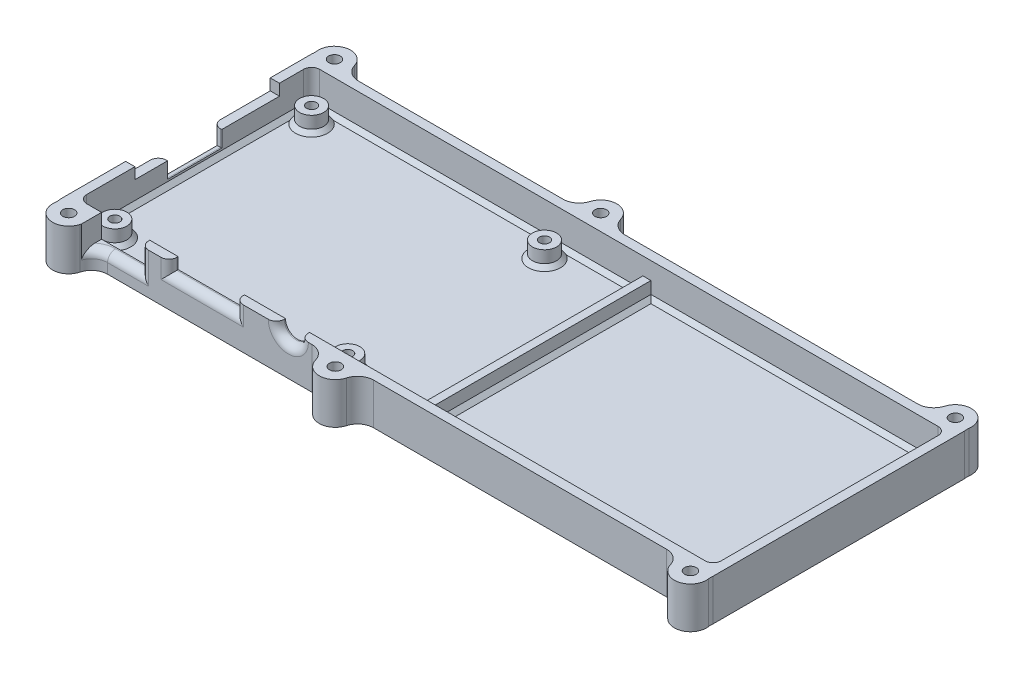
from build123d import *

# Parameters (mm, degrees)
SKETCH3_W                      = 162.6
SKETCH3_H                      = 62.6
SKETCH3_W_2                    = 158
SKETCH3_H_2                    = 58
BOSS_EXTRUDE1_DEPTH            = 10.3
SKETCH5_W                      = 158
SKETCH5_H                      = 58
BOSS_EXTRUDE2_DEPTH            = 2
SKETCH6_R                      = 3
BOSS_EXTRUDE3_DEPTH            = 4
F_2_5_2_5_DIAMETER_HOLE1_D     = 2.5
F_2_5_2_5_DIAMETER_HOLE1_DEPTH = 8
F_2_5_2_5_DIAMETER_HOLE1_TIP   = 0.751075774
SKETCH10_W                     = 2
SKETCH10_H                     = 58
BOSS_EXTRUDE4_DEPTH            = 4
CUT_EXTRUDE1_REACH             = 110.272
SKETCH11_R                     = 3
SKETCH11_W                     = 12
SKETCH11_H                     = 5.8
SKETCH11_W_2                   = 16.5
SKETCH11_H_2                   = 2.8
CUT_EXTRUDE2_REACH             = 168.519
SKETCH12_W                     = 13.5
SKETCH12_H                     = 6.8
SKETCH12_W_2                   = 36
SKETCH12_H_2                   = 2.8
SKETCH13_R                     = 4
BOSS_EXTRUDE5_DEPTH            = 10.3
FILLET2_R                      = 4
FILLET3_R                      = 4
FILLET4_R                      = 4
F_2_9_2_9_DIAMETER_HOLE1_D     = 2.9
FILLET6_R                      = 2
FILLET7_R                      = 2
FILLET8_R                      = 2
CHAMFER1_SIZE                  = 1
CHAMFER2_SIZE                  = 1
FILLET9_R                      = 2


with BuildPart() as part:
    # Sketch3 → Boss-Extrude1 (new body)
    with BuildSketch(Plane(origin=(0, 0, 0), x_dir=(1, 0, 0), z_dir=(0, 1, 0))):
        with Locations((6.438233838, 3.105993834)):
            Rectangle(SKETCH3_W, SKETCH3_H)
        with Locations((6.438233838, 3.105993834)):
            Rectangle(SKETCH3_W_2, SKETCH3_H_2, mode=Mode.SUBTRACT)
    extrude(amount=BOSS_EXTRUDE1_DEPTH)

    # Sketch5 → Boss-Extrude2 (add)
    with BuildSketch(Plane(origin=(0, 0, 0), x_dir=(1, 0, 0), z_dir=(0, 1, 0))):
        with Locations((6.438233838, 3.105993834)):
            Rectangle(SKETCH5_W, SKETCH5_H)
    extrude(amount=BOSS_EXTRUDE2_DEPTH)

    # Sketch6 → Boss-Extrude3 (add)
    with BuildSketch(Plane(origin=(0, 2, 0), x_dir=(1, 0, 0), z_dir=(0, 1, 0))):
        with Locations(Location((-68.061766162, 27.605993834, 0), (0, 0, 270))):
            Circle(SKETCH6_R)
        with Locations(Location((-68.061766162, -21.394006166, 0), (0, 0, 270))):
            Circle(SKETCH6_R)
        with Locations(Location((-10.061766162, -21.394006166, 0), (0, 0, 270))):
            Circle(SKETCH6_R)
        with Locations(Location((-10.061766162, 27.605993834, 0), (0, 0, 270))):
            Circle(SKETCH6_R)
    extrude(amount=BOSS_EXTRUDE3_DEPTH)

    # Ø2.5 (2.5) Diameter Hole1
    with Locations(Plane(origin=(0, 6, 0), x_dir=(1, 0, 0), z_dir=(0, 1, 0))):
        with Locations((-68.061766162, 27.605993834), (-10.061766162, 27.605993834), (-10.061766162, -21.394006166), (-68.061766162, -21.394006166)):
            Hole(F_2_5_2_5_DIAMETER_HOLE1_D / 2, depth=F_2_5_2_5_DIAMETER_HOLE1_DEPTH)
            with Locations((0, 0, -(F_2_5_2_5_DIAMETER_HOLE1_DEPTH + F_2_5_2_5_DIAMETER_HOLE1_TIP / 2))):  # 118° drill point
                Cone(0, F_2_5_2_5_DIAMETER_HOLE1_D / 2, F_2_5_2_5_DIAMETER_HOLE1_TIP, mode=Mode.SUBTRACT)

    # Sketch10 → Boss-Extrude4 (add)
    with BuildSketch(Plane(origin=(0, 2, 0), x_dir=(1, 0, 0), z_dir=(0, 1, 0))):
        with Locations((10.938233838, 3.105993834)):
            Rectangle(SKETCH10_W, SKETCH10_H)
    extrude(amount=BOSS_EXTRUDE4_DEPTH)

    # Sketch11 → Cut-Extrude1 (cut, up to next)
    with BuildSketch(Plane.XY.offset(28.194006166), mode=Mode.PRIVATE) as cut_extrude1_sk1:
        with Locations((-18.061766162, 10.3)):
            Circle(SKETCH11_R)
    cut_extrude1_tool1 = extrude(cut_extrude1_sk1.sketch, amount=-CUT_EXTRUDE1_REACH, mode=Mode.PRIVATE) & part.part
    # Sketch11 → Cut-Extrude1 (cut, up to next)
    with BuildSketch(Plane.XY.offset(28.194006166), mode=Mode.PRIVATE) as cut_extrude1_sk2:
        with Locations((-60.861766162, 7.4)):
            Rectangle(SKETCH11_W, SKETCH11_H)
    cut_extrude1_tool2 = extrude(cut_extrude1_sk2.sketch, amount=-CUT_EXTRUDE1_REACH, mode=Mode.PRIVATE) & part.part
    # Sketch11 → Cut-Extrude1 (cut, up to next)
    with BuildSketch(Plane.XY.offset(28.194006166), mode=Mode.PRIVATE) as cut_extrude1_sk3:
        with Locations((-39.527982648, 8.9)):
            Rectangle(SKETCH11_W_2, SKETCH11_H_2)
    cut_extrude1_tool3 = extrude(cut_extrude1_sk3.sketch, amount=-CUT_EXTRUDE1_REACH, mode=Mode.PRIVATE) & part.part
    add(cut_extrude1_tool1.solids().sort_by_distance((-18.061766, 10.3, 28.194006))[0], mode=Mode.SUBTRACT)
    add(cut_extrude1_tool2.solids().sort_by_distance((-60.861766, 7.4, 28.194006))[0], mode=Mode.SUBTRACT)
    add(cut_extrude1_tool3.solids().sort_by_distance((-39.527983, 8.9, 28.194006))[0], mode=Mode.SUBTRACT)

    # Sketch12 → Cut-Extrude2 (cut, up to next)
    with BuildSketch(Plane.ZY.offset(74.861766162), mode=Mode.PRIVATE) as cut_extrude2_sk1:
        with Locations((-2.982922372, 6.9)):
            Rectangle(SKETCH12_W, SKETCH12_H)
    cut_extrude2_tool1 = extrude(cut_extrude2_sk1.sketch, amount=-CUT_EXTRUDE2_REACH, mode=Mode.PRIVATE) & part.part
    # Sketch12 → Cut-Extrude2 (cut, up to next)
    with BuildSketch(Plane.ZY.offset(74.861766162), mode=Mode.PRIVATE) as cut_extrude2_sk2:
        with Locations((-6.105993834, 8.9)):
            Rectangle(SKETCH12_W_2, SKETCH12_H_2)
    cut_extrude2_tool2 = extrude(cut_extrude2_sk2.sketch, amount=-CUT_EXTRUDE2_REACH, mode=Mode.PRIVATE) & part.part
    add(cut_extrude2_tool1.solids().sort_by_distance((-74.861766, 6.9, -2.982922))[0], mode=Mode.SUBTRACT)
    add(cut_extrude2_tool2.solids().sort_by_distance((-74.861766, 8.9, -6.105994))[0], mode=Mode.SUBTRACT)

    # Sketch13 → Boss-Extrude5 (add)
    with BuildSketch(Plane(origin=(0, 0, 0), x_dir=(1, 0, 0), z_dir=(0, 1, 0))):
        with Locations((-70.861766162, 36.105993834)):
            Circle(SKETCH13_R)
        with Locations((-4.561766162, 36.105993834)):
            Circle(SKETCH13_R)
        with Locations((83.738233838, 36.105993834)):
            Circle(SKETCH13_R)
        with Locations((83.788193598, -29.900023528)):
            Circle(SKETCH13_R)
        with Locations((-4.511705229, -30.033691472)):
            Circle(SKETCH13_R)
        with Locations((-70.811629263, -30.134055965)):
            Circle(SKETCH13_R)
    extrude(amount=BOSS_EXTRUDE5_DEPTH)

    # Fillet2
    # the kernel refuses this fillet: 4 mm, written as the material it adds along each edge
    with BuildSketch(Plane(origin=(-74.48253956, 10.3, -34.405993834), x_dir=(-1, 0, 0), z_dir=(0, -1, 0))) as fillet2_piece_1:
        with BuildLine():
            CenterArc((4.316902517, 0.703355094), FILLET2_R, 172.843462622, 17.284010607)
            Line((0.348064559, 1.201677547), (0.2686878, 1.211643996))
            ThreePointArc((0.2686878, 1.211643996), (0.144462277, 0.609403692), (-0.072415468, 0.034))
            Line((-0.072415468, 0.034), (0, -0.08))
            ThreePointArc((0, -0.08), (0.189613301, -0.08), (0.300473084, -0.014067102))
            Line((0.300473084, -0.014067102), (0.379226602, 0))
        make_face()
    extrude(amount=10.3)

    # Fillet3
    fillet3_edges = [part.edges().sort_by_distance(p)[0] for p in [
        (80.170251537, 5.15, 28.194006166),
        (-67.313600279, 5.15, 28.194006166),
        (-0.959866554, 5.15, 28.194006166),
        (-8.063543904, 5.15, 28.194006166),
        (80.11746044, 5.15, -34.405993834),
        (-8.18253956, 5.15, -34.405993834),
        (-0.940992764, 5.15, -34.405993834),
        (-67.240992764, 5.15, -34.405993834),
    ]]
    fillet(fillet3_edges, radius=FILLET3_R)

    # Fillet4
    # the kernel refuses this fillet: 4 mm, written as the material it adds along each edge
    with BuildSketch(Plane(origin=(-74.309658248, 10.3, 28.194006166), x_dir=(-0.3104883041224667, 0, 0.9505771999175842), z_dir=(0, -1, 0))) as fillet4_piece_1:
        with BuildLine():
            CenterArc((2.274210055, 3.927509369), FILLET4_R, 238.284839943, 20.790532392)
            Line((0.17142305, 0.524821195), (0.12936731, 0.456767432))
            ThreePointArc((0.12936731, 0.456767432), (0.009665349, 0.287249662), (-0.076046176, 0.024839064))
            Line((-0.076046176, 0.024839064), (0.0151614, -0.078550187))
            ThreePointArc((0.0151614, -0.078550187), (0.758070018, -0.007509369), (1.500978636, -0.078550187))
            Line((1.500978636, -0.078550187), (1.516140037, 0))
        make_face()
    extrude(amount=10.3)
    with BuildSketch(Plane(origin=(87.40613566, 10.3, 28.194006166), x_dir=(0.28950004404714813, 0, 0.9571780004245288), z_dir=(0, -1, 0))) as fillet4_piece_2_section:
        with BuildLine():
            CenterArc((1.756703704, -3.95690665), FILLET4_R, 98.41789371, 16.110259487)
            Line((0.096142437, -0.31787707), (0.062931212, -0.245096478))
            ThreePointArc((0.062931212, -0.245096478), (-0.028503021, -0.182098539), (-0.07657424, -0.023160004))
            Line((-0.07657424, -0.023160004), (0.011711358, 0.079138133))
            ThreePointArc((0.011711358, 0.079138133), (0.585567901, 0.03690665), (1.159424444, 0.079138133))
            Line((1.159424444, 0.079138133), (1.171135802, 0))
        make_face()
    fillet4_piece_2 = extrude(amount=10.3, mode=Mode.PRIVATE)
    fillet4_piece_2 = split(fillet4_piece_2, bisect_by=Plane(origin=(87.738233838, 5.15, 28.552797163), z_dir=(-1, 0, 0)), keep=Keep.TOP, mode=Mode.PRIVATE)
    add(fillet4_piece_2)
    with BuildSketch(Plane(origin=(87.359007236, 10.3, -34.405993834), x_dir=(1, 0, 0), z_dir=(0, -1, 0))) as fillet4_piece_3:
        with BuildLine():
            CenterArc((4.316902517, -0.703355094), FILLET4_R, 169.87252677, 17.284010607)
            Line((0.348064559, -1.201677547), (0.2686878, -1.211643996))
            ThreePointArc((0.2686878, -1.211643996), (0.144462277, -0.609403692), (-0.072415468, -0.034))
            Line((-0.072415468, -0.034), (0, 0.08))
            ThreePointArc((0, 0.08), (0.189613301, 0.08), (0.300473084, 0.014067102))
            Line((0.300473084, 0.014067102), (0.379226602, 0))
        make_face()
    extrude(amount=10.3)

    # Ø2.9 (2.9) Diameter Hole1 (through all)
    with Locations(Plane(origin=(0, 10.3, 0), x_dir=(1, 0, 0), z_dir=(0, 1, 0))):
        with Locations((-70.861766162, 36.105993834), (-4.561766162, 36.105993834), (83.738233838, 36.105993834), (83.788193598, -29.900023528), (-4.511705229, -30.033691472), (-70.811629263, -30.134055965)):
            Hole(F_2_9_2_9_DIAMETER_HOLE1_D / 2)

    # Fillet6
    fillet6_edges = [part.edges().sort_by_distance(p)[0] for p in [
        (85.438233838, 6.15, -32.105993834),
    ]]
    fillet(fillet6_edges, radius=FILLET6_R)

    # Fillet7
    fillet7_edges = [part.edges().sort_by_distance(p)[0] for p in [
        (85.438233838, 6.15, 25.894006166),
    ]]
    fillet(fillet7_edges, radius=FILLET7_R)

    # Fillet8
    fillet8_edges = [part.edges().sort_by_distance(p)[0] for p in [
        (-72.561766162, 6.15, -32.105993834),
        (-72.561766162, 6.15, 25.894006166),
    ]]
    fillet(fillet8_edges, radius=FILLET8_R)

    # Chamfer1
    chamfer1_edges = [part.edges().sort_by_distance(p)[0] for p in [
        (-68.061766162, 2, -30.605993834),
        (-68.061766162, 2, 18.394006166),
        (-10.061766162, 2, 18.394006166),
        (-10.061766162, 2, -30.605993834),
    ]]
    chamfer(chamfer1_edges, length=CHAMFER1_SIZE)

    # Chamfer2
    # the kernel refuses this chamfer: 1 mm, written as the material it adds along each edge
    with BuildSketch(Plane(origin=(9.36655085, 2, -32.105993834), x_dir=(0, 0.9996219169112968, -0.027495876610589075), z_dir=(1, 0, 0)), Plane(origin=(83.438233838, 2, 25.894006166), x_dir=(0, 0.9996219169112968, 0.027495876610585623), z_dir=(-1, 0, 0))) as chamfer2_piece_1:
        Polygon((CHAMFER2_SIZE * 0.999621916911, CHAMFER2_SIZE * 0.0274958766106), (-CHAMFER2_SIZE * 0.0274958766106, CHAMFER2_SIZE * 0.999621916911), (0, 0), align=None)
    extrude(amount=74.071682988)
    with BuildSketch(Plane(origin=(83.438233838, 2, -30.105993834), x_dir=(1, 0, 0), z_dir=(0, 0, 1))) as chamfer2_piece_2:
        Polygon((2 - CHAMFER2_SIZE, 0), (2, CHAMFER2_SIZE), (2, 0), align=None)
    revolve(axis=Axis((83.438233838, 2, -30.105993834), (0, 1, 0)), revolution_arc=90)
    with BuildSketch(Plane(origin=(85.438233838, 2, -30.105993834), x_dir=(-0.9996219169112968, -0.02749587661058639, 0), z_dir=(0, 0, 1)), Plane(origin=(-72.561766162, 2, 23.894006166), x_dir=(0.9996219169112968, -0.027495876610586605, 0), z_dir=(0, 0, -1))) as chamfer2_piece_3:
        Polygon((CHAMFER2_SIZE * 0.999621916911, -CHAMFER2_SIZE * 0.0274958766106), (-CHAMFER2_SIZE * 0.0274958766106, -CHAMFER2_SIZE * 0.999621916911), (0, 0), align=None)
    extrude(amount=54)
    with BuildSketch(Plane(origin=(83.438233838, 2, 23.894006166), x_dir=(1, 0, 0), z_dir=(0, 0, -1))) as chamfer2_piece_4:
        Polygon((2 - CHAMFER2_SIZE, 0), (2, -CHAMFER2_SIZE), (2, 0), align=None)
    revolve(axis=Axis((83.438233838, 2, 23.894006166), (0, -1, 0)), revolution_arc=90)
    with BuildSketch(Plane(origin=(12.509916826, 2, 25.894006166), x_dir=(0, -0.027495876610586296, -0.9996219169112968), z_dir=(-1, 0, 0)), Plane(origin=(-70.561766162, 2, -32.105993834), x_dir=(0, -0.027495876610586296, 0.9996219169112968), z_dir=(1, 0, 0))) as chamfer2_piece_5:
        Polygon((CHAMFER2_SIZE * 0.999621916911, -CHAMFER2_SIZE * 0.0274958766106), (-CHAMFER2_SIZE * 0.0274958766106, -CHAMFER2_SIZE * 0.999621916911), (0, 0), align=None)
    extrude(amount=83.071682988)
    with BuildSketch(Plane(origin=(-70.561766162, 2, -30.105993834), x_dir=(0, 0, -1), z_dir=(1, 0, 0))) as chamfer2_piece_6:
        Polygon((2 - CHAMFER2_SIZE, 0), (2, CHAMFER2_SIZE), (2, 0), align=None)
    revolve(axis=Axis((-70.561766162, 2, -30.105993834), (0, 1, 0)), revolution_arc=90)
    with BuildSketch(Plane(origin=(-70.561766162, 2, 23.894006166), x_dir=(0, 0, 1), z_dir=(1, 0, 0))) as chamfer2_piece_7:
        Polygon((2 - CHAMFER2_SIZE, 0), (2, -CHAMFER2_SIZE), (2, 0), align=None)
    revolve(axis=Axis((-70.561766162, 2, 23.894006166), (0, -1, 0)), revolution_arc=90)
    with BuildSketch(Plane(origin=(9.938233838, 2, 28.465689154), x_dir=(-0.9996219169112968, -0.027495876610586296, 0), z_dir=(0, 0, -1))) as chamfer2_piece_8_section:
        Polygon((CHAMFER2_SIZE * 0.999621916911, CHAMFER2_SIZE * 0.0274958766106), (-CHAMFER2_SIZE * 0.0274958766106, CHAMFER2_SIZE * 0.999621916911), (0, 0), align=None)
    chamfer2_piece_8 = extrude(amount=63.143365976, mode=Mode.PRIVATE)
    chamfer2_piece_8 = split(chamfer2_piece_8, bisect_by=Plane(origin=(9.604900504, 2.333333333, 28.194006166), z_dir=(0, 0, -1)), keep=Keep.TOP, mode=Mode.PRIVATE)
    chamfer2_piece_8 = split(chamfer2_piece_8, bisect_by=Plane(origin=(9.604900504, 2.333333333, -34.405993834), z_dir=(0, 0, 1)), keep=Keep.TOP, mode=Mode.PRIVATE)
    add(chamfer2_piece_8)
    with BuildSketch(Plane(origin=(11.938233838, 2, -34.677676822), x_dir=(-0.027495876610585623, 0.9996219169112968, 0), z_dir=(0, 0, 1))) as chamfer2_piece_9_section:
        Polygon((CHAMFER2_SIZE * 0.999621916911, -CHAMFER2_SIZE * 0.0274958766106), (-CHAMFER2_SIZE * 0.0274958766106, -CHAMFER2_SIZE * 0.999621916911), (0, 0), align=None)
    chamfer2_piece_9 = extrude(amount=63.143365976, mode=Mode.PRIVATE)
    chamfer2_piece_9 = split(chamfer2_piece_9, bisect_by=Plane(origin=(12.271567171, 2.333333333, 28.194006166), z_dir=(0, 0, -1)), keep=Keep.TOP, mode=Mode.PRIVATE)
    chamfer2_piece_9 = split(chamfer2_piece_9, bisect_by=Plane(origin=(12.271567171, 2.333333333, -34.405993834), z_dir=(0, 0, 1)), keep=Keep.TOP, mode=Mode.PRIVATE)
    add(chamfer2_piece_9)

    # Fillet9
    fillet9_edges = [part.edges().sort_by_distance(p)[0] for p in [
        (-54.861766162, 7.4, 28.194006166),
        (-47.777982648, 8.9, 28.194006166),
        (-39.527982648, 7.5, 28.194006166),
        (-31.277982648, 8.9, 28.194006166),
        (-18.061766162, 7.3, 28.194006166),
        (-74.861766162, 5.5, -9.732922372),
        (-74.861766162, 3.5, -2.982922372),
        (-74.861766162, 5.5, 3.767077628),
        (-58.971577884, 4.5, 28.194006166),
        (-65.402082249, 4.5, 28.936033536),
    ]]
    fillet(fillet9_edges, radius=FILLET9_R)


solid = part.part
